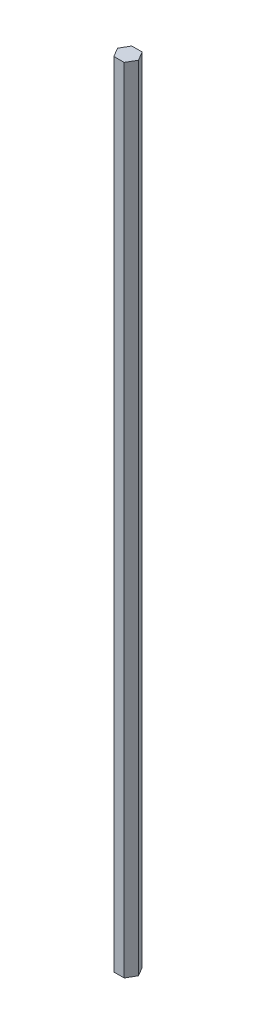
from build123d import *

# Parameters (mm, degrees)
BOSS_EXTRUDE1_DEPTH = 558.8


with BuildPart() as part:
    # Sketch1 → Boss-Extrude1 (new body)
    with BuildSketch(Plane(origin=(0, 0, 0), x_dir=(1, 0, 0), z_dir=(0, 1, 0))):
        Polygon((7.332348419, 0), (3.666174209, 6.35), (-3.666174209, 6.35), (-7.332348419, 0), (-3.666174209, -6.35), (3.666174209, -6.35), align=None)
    extrude(amount=BOSS_EXTRUDE1_DEPTH)


solid = part.part
